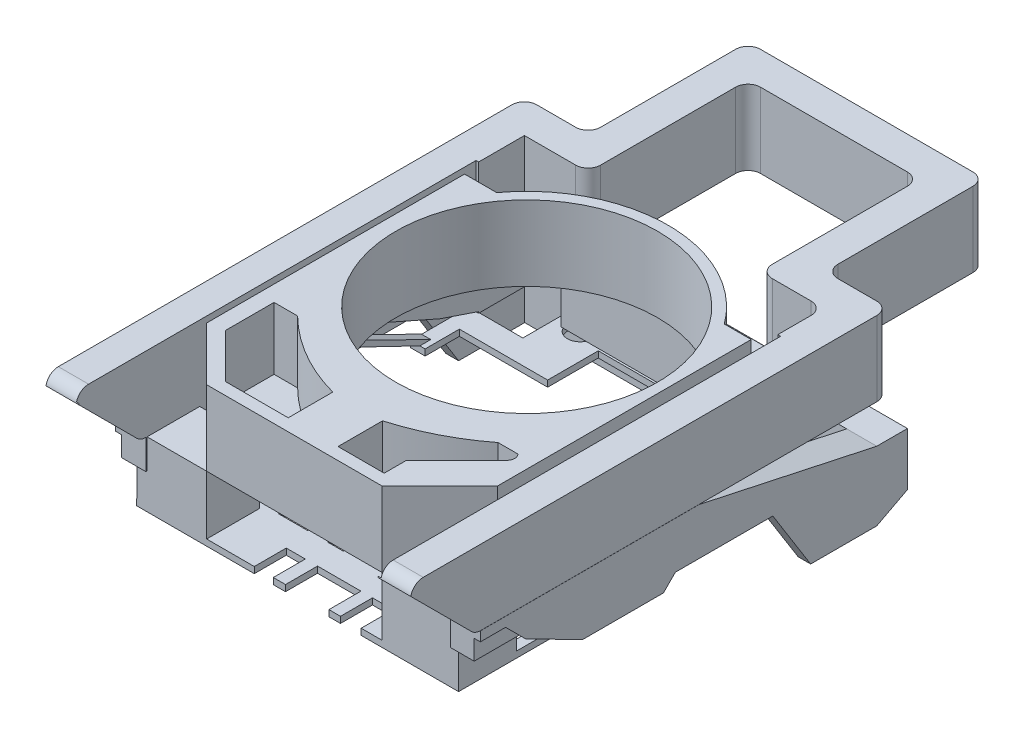
from build123d import *

# Parameters (mm, degrees)
SKETCH1_W                       = 2.64
SKETCH1_H                       = 35.75
SKETCH1_W_2                     = 6.889766764
SKETCH1_H_2                     = 2.63
SKETCH1_W_3                     = 7.750233236
BOSS_EXTRUDE1_DEPTH             = 6
CUT_EXTRUDE1_REACH              = 41.357
FILLET1_R                       = 1
BOSS_EXTRUDE2_DEPTH             = 29.28
SKETCH4_W                       = 1.408558316
SKETCH4_H                       = 5.304814482
CUT_EXTRUDE2_DEPTH              = 3.8
CUT_EXTRUDE3_REACH              = 34.92
SKETCH5_W                       = 4.9
SKETCH5_H                       = 5.304814482
SKETCH6_W                       = 1.4
SKETCH6_H                       = 5.304814482
CUT_EXTRUDE4_DEPTH              = 3.8
CUT_EXTRUDE5_REACH              = 34.92
SKETCH7_W                       = 19.54061977
SKETCH7_H                       = 5.304814482
CUT_EXTRUDE6_DEPTH              = 32.417597106
CUT_EXTRUDE6_DEPTH_BACK         = 32.417597106
SKETCH9_W                       = 24.44061977
SKETCH9_H                       = 32.058355928
CUT_EXTRUDE15_REACH             = 40.106
CUT_EXTRUDE15_DIRECTION_2_REACH = 40.106
CUT_EXTRUDE16_DEPTH             = 0.5
CUT_EXTRUDE17_DEPTH             = 0.5
SKETCH13_W                      = 17.501754415
SKETCH13_H                      = 0.016190478
CUT_EXTRUDE19_DEPTH             = 0.01
SKETCH14_W                      = 17.883217612
SKETCH14_H                      = 0.07574504
CUT_EXTRUDE20_DEPTH             = 0.01
BOSS_EXTRUDE3_DEPTH             = 6.01
CUT_EXTRUDE21_DEPTH             = 5
SKETCH17_W                      = 6.134661387
SKETCH17_H                      = 4.639832664
SKETCH17_W_2                    = 5.572592583
SKETCH17_H_2                    = 4.22008209
BOSS_EXTRUDE4_DEPTH             = 4.711076
SKETCH18_W                      = 15.829927538
SKETCH18_H                      = 2.113311738
BOSS_EXTRUDE5_DEPTH             = 4.711076448
SKETCH19_W                      = 25.836458988
SKETCH19_H                      = 9.760008925
BOSS_EXTRUDE6_DEPTH             = 0.5
SKETCH20_W                      = 1.659482959
SKETCH20_H                      = 3.40689524
SKETCH20_W_2                    = 3.483642293
SKETCH20_W_3                    = 1.525839126
SKETCH20_W_4                    = 6.904425604
SKETCH20_H_2                    = 1.436423046
SKETCH20_W_5                    = 1.355745624
SKETCH20_H_3                    = 0.797647359
SKETCH20_H_4                    = 1.848690379
SKETCH20_W_6                    = 1.26745566
SKETCH20_W_7                    = 8.724684606
SKETCH20_W_8                    = 2.035063803
SKETCH20_H_5                    = 2.961931601
SKETCH20_W_9                    = 2.355839583
SKETCH20_H_6                    = 2.623043487
SKETCH20_R                      = 1.110824032
SKETCH20_R_2                    = 1.101664622
CUT_EXTRUDE22_DEPTH             = 0.5
BOSS_EXTRUDE7_START             = -0.83177
BOSS_EXTRUDE7_DEPTH             = 25.836459
CUT_EXTRUDE23_REACH             = 33.558
SKETCH22_W                      = 24.24965972
SKETCH22_H                      = 13.26608919
BOSS_EXTRUDE10_REACH            = 33.383
SKETCH25_W                      = 25.822216624
SKETCH25_H                      = 9.101439168
SKETCH26_R                      = 1.022864177
CUT_EXTRUDE25_DEPTH             = 0.5


with BuildPart() as part:
    # Sketch1 → Boss-Extrude1 (new body)
    with BuildSketch(Plane(origin=(0, 0, 0), x_dir=(1, 0, 0), z_dir=(0, 1, 0))):
        Polygon((-6.889766764, 10.144400492), (-6.889766764, 12.774400492), (-9.519766764, 12.774400492), (-14.64, 12.774400492), (-14.64, 10.144400492), (-12, 10.144400492), align=None)
        with Locations((-13.32, -7.730599508)):
            Rectangle(SKETCH1_W, SKETCH1_H)
        Polygon((-6.889766764, 22.975599508), (-6.889766764, 25.605599508), (-9.519766764, 25.605599508), (-9.519766764, 12.774400492), (-6.889766764, 12.774400492), align=None)
        with Locations((-3.444883382, 24.290599508)):
            Rectangle(SKETCH1_W_2, SKETCH1_H_2)
        with Locations((3.444883382, 24.290599508)):
            Rectangle(SKETCH1_W_2, SKETCH1_H_2)
        Polygon((9.519766764, 25.605599508), (6.889766764, 25.605599508), (6.889766764, 22.975599508), (6.889766764, 12.774400492), (9.519766764, 12.774400492), align=None)
        with Locations((10.764883382, 11.459400492)):
            Rectangle(SKETCH1_W_3, SKETCH1_H_2)
        with Locations((13.32, -7.730599508)):
            Rectangle(SKETCH1_W, SKETCH1_H)
    extrude(amount=BOSS_EXTRUDE1_DEPTH)

    # Cut-Extrude1: up to this face of the body (flat: up to its plane)
    cut_extrude1_end = Plane(part.part.faces().sort_by_distance((14.64, 3, 6.415599508))[0])
    # Sketch2 → Cut-Extrude1 (cut, up to the picked face)
    with BuildSketch(Plane.ZY.offset(14.64), mode=Mode.PRIVATE) as cut_extrude1_sk1:
        Polygon((25.605599508, 5.159087432), (20.446512077, 0), (25.605599508, 0), align=None)
    cut_extrude1_tool1 = split(extrude(cut_extrude1_sk1.sketch, amount=-CUT_EXTRUDE1_REACH, mode=Mode.PRIVATE), bisect_by=cut_extrude1_end, keep=Keep.BOTH, mode=Mode.PRIVATE)
    add(cut_extrude1_tool1.solids().sort_by(Axis((-14.64, 1.719696, 23.885904), (1, 0, 0)))[0], mode=Mode.SUBTRACT)

    # Fillet1
    # the kernel refuses this fillet: 1 mm, written as the material it adds along each edge
    with BuildSketch(Plane(origin=(12, 0, -10.144400492), x_dir=(-1, 0, 0), z_dir=(0, 1, 0)), Plane(origin=(6.889766764, 0, -22.975599508), x_dir=(-1, 0, 0), z_dir=(0, 1, 0)), Plane(origin=(-6.889766764, 0, -22.975599508), x_dir=(0, 0, 1), z_dir=(0, 1, 0)), Plane(origin=(-9.519766764, 0, -12.774400492), x_dir=(0, 0, -1), z_dir=(0, 1, 0)), Plane(origin=(9.519766764, 0, -12.774400492), x_dir=(1, 0, 0), z_dir=(0, 1, 0))) as fillet1_piece_1:
        with BuildLine():
            CenterArc((FILLET1_R, FILLET1_R), FILLET1_R, 180, 90)
            Line((0, FILLET1_R), (0, 0))
            Line((0, 0), (FILLET1_R, 0))
        make_face()
    extrude(amount=6)
    # the kernel refuses this fillet: 1 mm, written as the material it takes off along each edge
    with BuildSketch(Plane(origin=(9.531838755, 6, 25.605599508), x_dir=(0, 0, -1), z_dir=(1, 0, 0))) as fillet1_2_piece_1:
        with BuildLine():
            CenterArc((0.987264498, -1), FILLET1_R, 90, 80.846068511)
            Line((0, -0.840912568), (0, 0))
            Line((0, 0), (0.987264498, 0))
        make_face()
    extrude(amount=7.57632249, mode=Mode.SUBTRACT)
    with BuildSketch(Plane(origin=(6.889766764, -2.5, -10.144400492), x_dir=(0, 0, -1), z_dir=(0, 1, 0)), Plane(origin=(-6.889766764, -2.5, -10.144400492), x_dir=(-1, 0, 0), z_dir=(0, 1, 0)), Plane(origin=(-14.64, -2.5, -12.774400492), x_dir=(1, 0, 0), z_dir=(0, 1, 0)), Plane(origin=(-9.519766764, -2.5, -25.605599508), x_dir=(1, 0, 0), z_dir=(0, 1, 0)), Plane(origin=(14.64, -2.5, -12.774400492), x_dir=(0, 0, 1), z_dir=(0, 1, 0)), Plane(origin=(9.519766764, -2.5, -25.605599508), x_dir=(0, 0, 1), z_dir=(0, 1, 0))) as fillet1_2_piece_2:
        with BuildLine():
            CenterArc((FILLET1_R, -FILLET1_R), FILLET1_R, 90, 90)
            Line((0, -FILLET1_R), (0, 0))
            Line((0, 0), (FILLET1_R, 0))
        make_face()
    extrude(amount=11, mode=Mode.SUBTRACT)
    with BuildSketch(Plane(origin=(-9.531838755, 6, 25.605599508), x_dir=(0, 0, -1), z_dir=(-1, 0, 0))) as fillet1_2_piece_3:
        with BuildLine():
            CenterArc((0.987264498, 1), FILLET1_R, 189.153931489, 80.846068511)
            Line((0, 0.840912568), (0, 0))
            Line((0, 0), (0.987264498, 0))
        make_face()
    extrude(amount=7.57632249, mode=Mode.SUBTRACT)
    with BuildSketch(Plane(origin=(-15.675533906, 0, 20.446512077), x_dir=(0, 0, -1), z_dir=(1, 0, 0)), Plane(origin=(10.964466094, 0, 20.446512077), x_dir=(0, 0, -1), z_dir=(1, 0, 0))) as fillet1_2_piece_4:
        with BuildLine():
            CenterArc((FILLET1_R * 0.414213562373, FILLET1_R), FILLET1_R, 225, 45)
            Line((-FILLET1_R * 0.292893218813, FILLET1_R * 0.292893218813), (0, 0))
            Line((0, 0), (FILLET1_R * 0.414213562373, 0))
        make_face()
    extrude(amount=4.711067812, mode=Mode.SUBTRACT)

    # Sketch3 → Boss-Extrude2 (add)
    with BuildSketch(Plane(origin=(14.64, 0, 0), x_dir=(0, 0, -1), z_dir=(1, 0, 0))):
        Polygon((-20.032298514, 0), (-2.532298514, 0), (11.774400492, -3.084011961), (14.234115991, -3.084011961), (14.234115991, -7.334011961), (11.774400492, -8.620770846), (6.46958601, -8.620770846), (3.431417345, -3.762544834), (-4.386659243, -3.762544834), (-5.345190858, -4.721076448), (-11.845190858, -4.721076448), (-16.415132789, -2.37), (-20.032298514, -2.37), align=None)
    extrude(amount=-BOSS_EXTRUDE2_DEPTH)

    # Sketch4 → Cut-Extrude2 (cut)
    with BuildSketch(Plane(origin=(0, -8.620770846, 0), x_dir=(-1, 0, 0), z_dir=(0, -1, 0))):
        with Locations((-12.935720842, 9.121993251)):
            Rectangle(SKETCH4_W, SKETCH4_H)
    extrude(amount=-CUT_EXTRUDE2_DEPTH, mode=Mode.SUBTRACT)

    # Cut-Extrude3: up to this plane
    cut_extrude3_end = Plane(origin=(-14.64, 0, 2.532298514), z_dir=(0, 0.9775456341870216, -0.21072383130983052))
    # Sketch5 → Cut-Extrude3 (cut, up to the surface)
    with BuildSketch(Plane(origin=(0, -8.620770846, 0), x_dir=(-1, 0, 0), z_dir=(0, -1, 0)), mode=Mode.PRIVATE) as cut_extrude3_sk1:
        with Locations((-9.781441684, 9.121993251)):
            Rectangle(SKETCH5_W, SKETCH5_H)
    cut_extrude3_tool1 = split(extrude(cut_extrude3_sk1.sketch, amount=-CUT_EXTRUDE3_REACH, mode=Mode.PRIVATE), bisect_by=cut_extrude3_end, keep=Keep.BOTH, mode=Mode.PRIVATE)
    add(cut_extrude3_tool1.solids().sort_by_distance((9.781442, -8.620771, -9.121993))[0], mode=Mode.SUBTRACT)

    # Sketch6 → Cut-Extrude4 (cut)
    with BuildSketch(Plane(origin=(0, -8.620770846, 0), x_dir=(-1, 0, 0), z_dir=(0, -1, 0))):
        with Locations((12.909178086, 9.121993251)):
            Rectangle(SKETCH6_W, SKETCH6_H)
    extrude(amount=-CUT_EXTRUDE4_DEPTH, mode=Mode.SUBTRACT)

    # Cut-Extrude5: up to this plane
    cut_extrude5_end = Plane(origin=(-14.64, 0, 2.532298514), z_dir=(0, 0.9775456341870216, -0.21072383130983052))
    # Sketch7 → Cut-Extrude5 (cut, up to the surface)
    with BuildSketch(Plane(origin=(0, -8.620770846, 0), x_dir=(-1, 0, 0), z_dir=(0, -1, 0)), mode=Mode.PRIVATE) as cut_extrude5_sk1:
        with Locations((2.438868201, 9.121993251)):
            Rectangle(SKETCH7_W, SKETCH7_H)
    cut_extrude5_tool1 = split(extrude(cut_extrude5_sk1.sketch, amount=-CUT_EXTRUDE5_REACH, mode=Mode.PRIVATE), bisect_by=cut_extrude5_end, keep=Keep.BOTH, mode=Mode.PRIVATE)
    add(cut_extrude5_tool1.solids().sort_by_distance((-2.438868, -8.620771, -9.121993))[0], mode=Mode.SUBTRACT)

    # Sketch9 → Cut-Extrude6 (cut, two sides: drawn at the far end of the back side and taken through both)
    with BuildSketch(Plane.XZ.offset(4.820770846).offset(-CUT_EXTRUDE6_DEPTH_BACK)):
        with Locations((0.011131799, 9.559591954)):
            Rectangle(SKETCH9_W, SKETCH9_H)
    extrude(amount=CUT_EXTRUDE6_DEPTH + CUT_EXTRUDE6_DEPTH_BACK, mode=Mode.SUBTRACT)

    # Cut-Extrude15: up to this face of the body (flat: up to its plane)
    cut_extrude15_end = Plane(part.part.faces().sort_by_distance((13.64, -6.720770846, -9.121993251))[0])
    # Sketch10 → Cut-Extrude15 (cut, up to the picked face)
    with BuildSketch(Plane.ZY.offset(-12.231441684), mode=Mode.PRIVATE) as cut_extrude15_sk1:
        Polygon((-3.431417345, -3.762544834), (-6.46958601, -8.620770846), (19.042952457, -10.431004186), (20.032298514, -3.568780901), (14.084983505, -3.568780901), (11.845190858, -4.721076448), (5.345190858, -4.721076448), (4.386659243, -3.762544834), align=None)
    cut_extrude15_tool1 = split(extrude(cut_extrude15_sk1.sketch, amount=-CUT_EXTRUDE15_REACH, mode=Mode.PRIVATE), bisect_by=cut_extrude15_end, keep=Keep.BOTH, mode=Mode.PRIVATE)
    # Sketch10 → Cut-Extrude15 (cut, up to the picked face)
    with BuildSketch(Plane.ZY.offset(-12.231441684), mode=Mode.PRIVATE) as cut_extrude15_sk2:
        Polygon((-3.609114591, -3.568780901), (-6.668491328, -4.603179695), (-6.668491328, -4.820770846), (-6.46958601, -4.820770846), (-6.46958601, -8.620770846), (-3.431417345, -3.762544834), (4.386659243, -3.762544834), (5.345190858, -4.721076448), (11.845190858, -4.721076448), (14.084983505, -3.568780901), (10.232585443, -3.568780901), (6.402975649, -0.208142334), (4.010789105, -0.208142334), align=None)
    cut_extrude15_tool2 = split(extrude(cut_extrude15_sk2.sketch, amount=-CUT_EXTRUDE15_REACH, mode=Mode.PRIVATE), bisect_by=cut_extrude15_end, keep=Keep.BOTH, mode=Mode.PRIVATE)
    add(cut_extrude15_tool1.solids().sort_by(Axis((12.231442, -6.831721, 7.899602), (1, 0, 0)))[0], mode=Mode.SUBTRACT)
    add(cut_extrude15_tool2.solids().sort_by(Axis((12.231442, -3.194232, 3.540101), (1, 0, 0)))[0], mode=Mode.SUBTRACT)

    # Cut-Extrude15 direction 2: up to this face of the body (flat: up to its plane)
    cut_extrude15_direction_2_end = Plane(part.part.faces().sort_by_distance((-13.609178086, -6.720770846, -9.121993251))[0])
    # Sketch10 → Cut-Extrude15 direction 2 (cut, up to the picked face)
    with BuildSketch(Plane.ZY.offset(-12.231441684), mode=Mode.PRIVATE) as cut_extrude15_direction_2_sk1:
        Polygon((-3.431417345, -3.762544834), (-6.46958601, -8.620770846), (19.042952457, -10.431004186), (20.032298514, -3.568780901), (14.084983505, -3.568780901), (11.845190858, -4.721076448), (5.345190858, -4.721076448), (4.386659243, -3.762544834), align=None)
    cut_extrude15_direction_2_tool1 = split(extrude(cut_extrude15_direction_2_sk1.sketch, amount=CUT_EXTRUDE15_DIRECTION_2_REACH, mode=Mode.PRIVATE), bisect_by=cut_extrude15_direction_2_end, keep=Keep.BOTH, mode=Mode.PRIVATE)
    # Sketch10 → Cut-Extrude15 direction 2 (cut, up to the picked face)
    with BuildSketch(Plane.ZY.offset(-12.231441684), mode=Mode.PRIVATE) as cut_extrude15_direction_2_sk2:
        Polygon((-3.609114591, -3.568780901), (-6.668491328, -4.603179695), (-6.668491328, -4.820770846), (-6.46958601, -4.820770846), (-6.46958601, -8.620770846), (-3.431417345, -3.762544834), (4.386659243, -3.762544834), (5.345190858, -4.721076448), (11.845190858, -4.721076448), (14.084983505, -3.568780901), (10.232585443, -3.568780901), (6.402975649, -0.208142334), (4.010789105, -0.208142334), align=None)
    cut_extrude15_direction_2_tool2 = split(extrude(cut_extrude15_direction_2_sk2.sketch, amount=CUT_EXTRUDE15_DIRECTION_2_REACH, mode=Mode.PRIVATE), bisect_by=cut_extrude15_direction_2_end, keep=Keep.BOTH, mode=Mode.PRIVATE)
    add(cut_extrude15_direction_2_tool1.solids().sort_by(Axis((12.231442, -6.831721, 7.899602), (-1, 0, 0)))[0], mode=Mode.SUBTRACT)
    add(cut_extrude15_direction_2_tool2.solids().sort_by(Axis((12.231442, -3.194232, 3.540101), (-1, 0, 0)))[0], mode=Mode.SUBTRACT)

    # Sketch11 → Cut-Extrude16 (cut)
    with BuildSketch(Plane(origin=(14.64, 0, 0), x_dir=(0, 0, -1), z_dir=(1, 0, 0))):
        Polygon((-16.415132789, -2.37), (-18.006808598, -0.778324191), (-20.032298514, -0.778324191), (-20.032298514, -2.37), align=None)
    extrude(amount=-CUT_EXTRUDE16_DEPTH, mode=Mode.SUBTRACT)

    # Sketch12 → Cut-Extrude17 (cut)
    with BuildSketch(Plane.ZY.offset(14.64)):
        Polygon((20.032298514, -0.778324191), (20.032298514, -2.37), (16.415132789, -2.37), (18.006808598, -0.778324191), align=None)
    extrude(amount=-CUT_EXTRUDE17_DEPTH, mode=Mode.SUBTRACT)

    # Sketch13 → Cut-Extrude19 (cut)
    with BuildSketch(Plane(origin=(14.64, 0, 0), x_dir=(0, 0, -1), z_dir=(1, 0, 0))):
        with Locations((-11.281421307, -0.004905337)):
            Rectangle(SKETCH13_W, SKETCH13_H)
    extrude(amount=-CUT_EXTRUDE19_DEPTH, mode=Mode.SUBTRACT)

    # Sketch14 → Cut-Extrude20 (cut)
    with BuildSketch(Plane.ZY.offset(14.64)):
        with Locations((11.473373141, 0.038247947)):
            Rectangle(SKETCH14_W, SKETCH14_H)
    extrude(amount=-CUT_EXTRUDE20_DEPTH, mode=Mode.SUBTRACT)



with BuildPart() as body_2:
    # Sketch15 → Boss-Extrude3 (new body)
    with BuildSketch(Plane(origin=(0, 6, 0), x_dir=(1, 0, 0), z_dir=(0, 1, 0))):
        with BuildLine():
            ThreePointArc((-9.146974967, 5.063128526), (-10.78901347, 1.87782118), (-11.355203827, -1.660808754))
            Line((-11.355203827, -1.660808754), (-10.514076976, -1.660808754))
            ThreePointArc((-10.514076976, -1.660808754), (-9.886485046, 1.914881237), (-8.078732422, 5.063128526))
            Line((-8.078732422, 5.063128526), (-9.146974967, 5.063128526))
        make_face()
        with BuildLine():
            ThreePointArc((9.118821014, 5.063128526), (-0.014076976, 9.680318097), (-9.146974967, 5.063128526))
            Line((-9.146974967, 5.063128526), (-8.078732422, 5.063128526))
            ThreePointArc((-8.078732422, 5.063128526), (-0.014076976, 8.839191246), (8.050578469, 5.063128526))
            Line((8.050578469, 5.063128526), (9.118821014, 5.063128526))
        make_face()
        with BuildLine():
            ThreePointArc((8.050578469, 5.063128526), (9.858331093, 1.914881237), (10.485923024, -1.660808754))
            Line((10.485923024, -1.660808754), (11.272835714, -1.660808754))
            Line((11.272835714, -1.660808754), (11.272835714, -0.553216691))
            ThreePointArc((11.272835714, -0.553216691), (10.574973994, 2.400368143), (9.118821014, 5.063128526))
            Line((9.118821014, 5.063128526), (8.050578469, 5.063128526))
        make_face()
        with BuildLine():
            Line((-10.514076976, -1.660808754), (-11.355203827, -1.660808754))
            ThreePointArc((-11.355203827, -1.660808754), (-0.568536026, -12.988373956), (11.272835714, -2.768400817))
            Line((11.272835714, -2.768400817), (11.272835714, -1.660808754))
            Line((11.272835714, -1.660808754), (10.485923024, -1.660808754))
            ThreePointArc((10.485923024, -1.660808754), (-0.014076976, -12.160808754), (-10.514076976, -1.660808754))
        make_face()
        with BuildLine():
            Line((-11.355203827, -1.660808754), (-11.722661537, -1.660808754))
            Line((-11.722661537, -1.660808754), (-11.722661537, -15.632044642))
            Line((-11.722661537, -15.632044642), (-7.432296754, -19.922409425))
            Line((-7.432296754, -19.922409425), (6.647372365, -19.922409425))
            Line((6.647372365, -19.922409425), (11.272835714, -15.296946076))
            Line((11.272835714, -15.296946076), (11.272835714, -2.768400817))
            ThreePointArc((11.272835714, -2.768400817), (-0.568536026, -12.988373956), (-11.355203827, -1.660808754))
        make_face()
        with BuildLine():
            Line((-11.722661537, 5.063128526), (-11.722661537, -1.660808754))
            Line((-11.722661537, -1.660808754), (-11.355203827, -1.660808754))
            ThreePointArc((-11.355203827, -1.660808754), (-10.78901347, 1.87782118), (-9.146974967, 5.063128526))
            Line((-9.146974967, 5.063128526), (-11.722661537, 5.063128526))
        make_face()
        with BuildLine():
            Line((11.272835714, 5.063128526), (9.118821014, 5.063128526))
            ThreePointArc((9.118821014, 5.063128526), (10.574973994, 2.400368143), (11.272835714, -0.553216691))
            Line((11.272835714, -0.553216691), (11.272835714, 5.063128526))
        make_face()
    extrude(amount=-BOSS_EXTRUDE3_DEPTH)

    # Sketch16 → Cut-Extrude21 (cut)
    with BuildSketch(Plane(origin=(0, 6, 0), x_dir=(1, 0, 0), z_dir=(0, 1, 0))):
        with BuildLine():
            Line((-10.450461444, -15.372959398), (-6.876203236, -18.947217606))
            Line((-6.876203236, -18.947217606), (-1.862064979, -18.947217606))
            Line((-1.862064979, -18.947217606), (-1.862064979, -15.372959398))
            ThreePointArc((-1.862064979, -15.372959398), (-5.462651837, -13.868790404), (-8.560002127, -11.495360131))
            Line((-8.560002127, -11.495360131), (-10.450461444, -11.495360131))
            Line((-10.450461444, -11.495360131), (-10.450461444, -15.372959398))
        make_face()
        with BuildLine():
            Line((2.132694018, -18.947217606), (2.132694018, -15.372959398))
            ThreePointArc((2.132694018, -15.372959398), (5.35283105, -14.102327054), (8.277066178, -12.249589088))
            Line((8.277066178, -12.249589088), (9.870812884, -12.249589088))
            ThreePointArc((9.870812884, -12.249589088), (10.052341145, -12.687837078), (9.870812884, -13.126085068))
            Line((9.870812884, -13.126085068), (5.83680945, -17.160088502))
            Line((5.83680945, -17.160088502), (5.83680945, -18.947217606))
            Line((5.83680945, -18.947217606), (2.132694018, -18.947217606))
        make_face()
    extrude(amount=-CUT_EXTRUDE21_DEPTH, mode=Mode.SUBTRACT)


with BuildPart() as part_1:
    add(part.part)

    add(body_2.part)  # Boss-Extrude4 merges body 2
    # Sketch17 → Boss-Extrude4 (add)
    with BuildSketch(Plane.XZ.offset(0.01)):
        with Locations((9.714703058, 17.602493093)):
            Rectangle(SKETCH17_W, SKETCH17_H)
        with Locations((-10.218593046, 17.81236838)):
            Rectangle(SKETCH17_W_2, SKETCH17_H_2)
    extrude(amount=BOSS_EXTRUDE4_DEPTH)

    # Sketch18 → Boss-Extrude5 (add)
    with BuildSketch(Plane.XZ.offset(0.01)):
        with Locations((-0.025197005, -10.087744623)):
            Rectangle(SKETCH18_W, SKETCH18_H)
    extrude(amount=BOSS_EXTRUDE5_DEPTH)


with BuildPart() as body_2_2:
    # Sketch19 → Boss-Extrude6 (new body)
    with BuildSketch(Plane(origin=(0, -4.721076448, 0), x_dir=(-1, 0, 0), z_dir=(0, -1, 0))):
        with Locations((0.136195742, -15.042404963)):
            Rectangle(SKETCH19_W, SKETCH19_H)
    extrude(amount=BOSS_EXTRUDE6_DEPTH)

    # Sketch20 → Cut-Extrude22 (cut)
    with BuildSketch(Plane(origin=(0, -5.221076448, 0), x_dir=(-1, 0, 0), z_dir=(0, -1, 0))):
        with Locations((-4.136306852, -19.058668123)):
            Rectangle(SKETCH20_W, SKETCH20_H)
        with Locations((-0.636880345, -19.058668123)):
            Rectangle(SKETCH20_W_2, SKETCH20_H)
        with Locations((2.84789009, -19.058668123)):
            Rectangle(SKETCH20_W_3, SKETCH20_H)
        Polygon((-11.950264063, -10.1624005), (-11.950264063, -16.127357897), (-10.638872719, -16.127357897), (-10.638872719, -11.598823546), (-10.638872719, -10.1624005), align=None)
        with Locations((-7.186659917, -10.880612023)):
            Rectangle(SKETCH20_W_4, SKETCH20_H_2)
        Polygon((-2.378701491, -11.598823546), (-3.734447115, -11.598823546), (-3.734447115, -15.285756467), (-2.378701491, -15.285756467), (-2.378701491, -13.447513925), align=None)
        with Locations((-3.056574303, -10.880612023)):
            Rectangle(SKETCH20_W_5, SKETCH20_H_2)
        with Locations((-3.056574303, -9.763576821)):
            Rectangle(SKETCH20_W_5, SKETCH20_H_3)
        with Locations((-0.636880345, -12.523168736)):
            Rectangle(SKETCH20_W_2, SKETCH20_H_4)
        with Locations((-0.636880345, -10.880612023)):
            Rectangle(SKETCH20_W_2, SKETCH20_H_2)
        Polygon((2.372396462, -11.598823546), (1.104940802, -11.598823546), (1.104940802, -13.447513925), (1.104940802, -15.285756467), (2.372396462, -15.285756467), align=None)
        with Locations((1.738668632, -10.880612023)):
            Rectangle(SKETCH20_W_6, SKETCH20_H_2)
        with Locations((1.738668632, -9.763576821)):
            Rectangle(SKETCH20_W_6, SKETCH20_H_3)
        with Locations((6.734738765, -10.880612023)):
            Rectangle(SKETCH20_W_7, SKETCH20_H_2)
        Polygon((11.097081068, -10.1624005), (11.097081068, -11.598823546), (11.097081068, -15.285756467), (12.299395657, -15.285756467), (12.299395657, -10.1624005), align=None)
        with Locations((-5.983580233, -13.804790667)):
            Rectangle(SKETCH20_W_8, SKETCH20_H_5)
        with Locations((5.127396069, -13.974234724)):
            Rectangle(SKETCH20_W_9, SKETCH20_H_6)
        with Locations(Location((-11.089739196, -18.466044535, 0), (0, 0, 90))):
            Circle(SKETCH20_R)
        with Locations(Location((11.393631752, -18.466044535, 0), (0, 0, 90))):
            Circle(SKETCH20_R_2)
    extrude(amount=-CUT_EXTRUDE22_DEPTH, mode=Mode.SUBTRACT)


with BuildPart() as boss_extrude7_tool:
    # Sketch21 → Boss-Extrude7 (new body)
    with BuildSketch(Plane.ZY.offset(-11.950264063).offset(BOSS_EXTRUDE7_START)):
        Polygon((10.1624005, -4.721076448), (6.410519682, -1.21919563), (4.167962546, -1.21919563), (-2.929320401, -4.721076448), (-2.0513239, -4.721076448), (4.167962546, -1.719500791), (6.34004443, -1.646685058), (10.1624005, -5.221076448), align=None)
    extrude(amount=BOSS_EXTRUDE7_DEPTH)


with BuildPart() as part_2:
    add(part_1.part)


with BuildPart() as part_3:
    # Boss-Extrude7: joined with boss_extrude7_tool
    add(part_2.part.fuse(boss_extrude7_tool.part, body_2_2.part, tol=0.00001))

    # Sketch22 → Cut-Extrude23 (cut, up to next)
    with BuildSketch(Plane(origin=(0, -5.221076448, 0), x_dir=(-1, 0, 0), z_dir=(0, -1, 0)), mode=Mode.PRIVATE) as cut_extrude23_sk1:
        with Locations((0.174565797, -3.529355905)):
            Rectangle(SKETCH22_W, SKETCH22_H)
    cut_extrude23_tool1 = extrude(cut_extrude23_sk1.sketch, amount=-CUT_EXTRUDE23_REACH, mode=Mode.PRIVATE) & part_3.part
    add(cut_extrude23_tool1.solids().sort_by_distance((-0.174566, -5.221076, 3.529356))[0], mode=Mode.SUBTRACT)

    # Boss-Extrude10: up to this face of the body (flat: up to its plane)
    boss_extrude10_end = Plane(part_3.part.faces().sort_by_distance((-0.460429575, -5.221076448, 15.802500325))[0])
    # Sketch25 → Boss-Extrude10 (add, up to the picked face)
    with BuildSketch(Plane(origin=(0, -4.721076448, 0), x_dir=(-1, 0, 0), z_dir=(0, -1, 0)), mode=Mode.PRIVATE) as boss_extrude10_sk1:
        with Locations((0.12907456, 6.602043484)):
            Rectangle(SKETCH25_W, SKETCH25_H)
    boss_extrude10_tool1 = split(extrude(boss_extrude10_sk1.sketch, amount=BOSS_EXTRUDE10_REACH, mode=Mode.PRIVATE), bisect_by=boss_extrude10_end, keep=Keep.BOTH, mode=Mode.PRIVATE)
    add(boss_extrude10_tool1.solids().sort_by(Axis((-0.129075, -4.721076, -6.602043), (0, -1, 0)))[0])

    # Sketch26 → Cut-Extrude25 (cut)
    with BuildSketch(Plane(origin=(0, -5.221076448, 0), x_dir=(-1, 0, 0), z_dir=(0, -1, 0))):
        Polygon((-12.782033752, 6.732079782), (-11.619457814, 6.732079782), (-8.45643732, 6.732079782), (-8.45643732, 11.152763068), (-12.782033752, 11.152763068), align=None)
        Polygon((-11.619457814, 2.0513239), (0.12907456, 2.0513239), (0.12907456, 8.866096025), (-4.54062327, 8.866096025), (-4.54062327, 6.732079782), (-4.54062327, 4.80347477), (-8.45643732, 4.80347477), (-11.619457814, 4.80347477), align=None)
        Polygon((0.12907456, 8.866096025), (0.12907456, 2.0513239), (11.877606934, 2.0513239), (11.877606934, 4.80347477), (8.71458644, 4.80347477), (4.79877239, 4.80347477), (4.79877239, 6.732079782), (4.79877239, 8.866096025), align=None)
        with Locations(Location((6.871617906, 9.4872711, 0), (0, 0, 90))):
            Circle(SKETCH26_R)
        with Locations(Location((-6.613468786, 9.4872711, 0), (0, 0, 90))):
            Circle(SKETCH26_R)
        Polygon((8.71458644, 6.732079782), (11.877606934, 6.732079782), (13.040182872, 6.732079782), (13.040182872, 11.152763068), (8.71458644, 11.152763068), align=None)
    extrude(amount=-CUT_EXTRUDE25_DEPTH, mode=Mode.SUBTRACT)


solid = part_3.part
